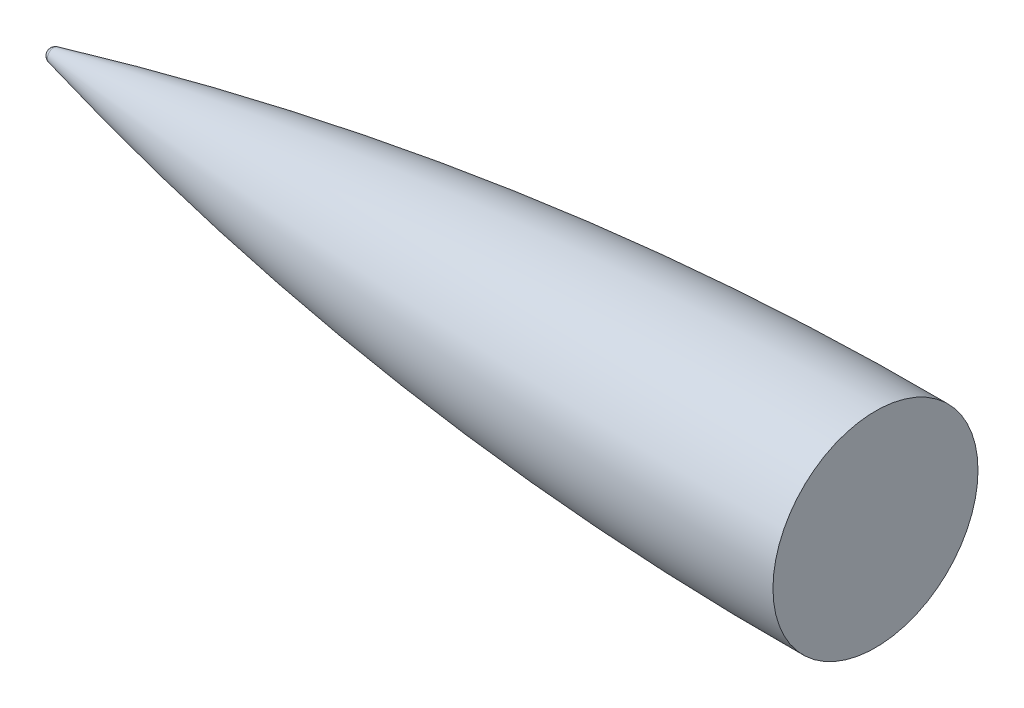
from build123d import *


with BuildPart() as part:
    # Sketch1 → Revolve1 (revolve)
    with BuildSketch(Plane.XY):
        with BuildLine():
            Line((325.525034954, 0), (325.525034954, 39.37))
            ThreePointArc((325.525034954, 39.37), (166.61365154, 30.589847094), (9.964123391, 2.467894911))
            ThreePointArc((9.964123391, 2.467894911), (8.567797441, 1.569280827), (8.025034954, 0))
            Line((8.025034954, 0), (325.525034954, 0))
        make_face()
    revolve(axis=Axis((325.525034954, 0, 0), (-1, 0, 0)))


solid = part.part
